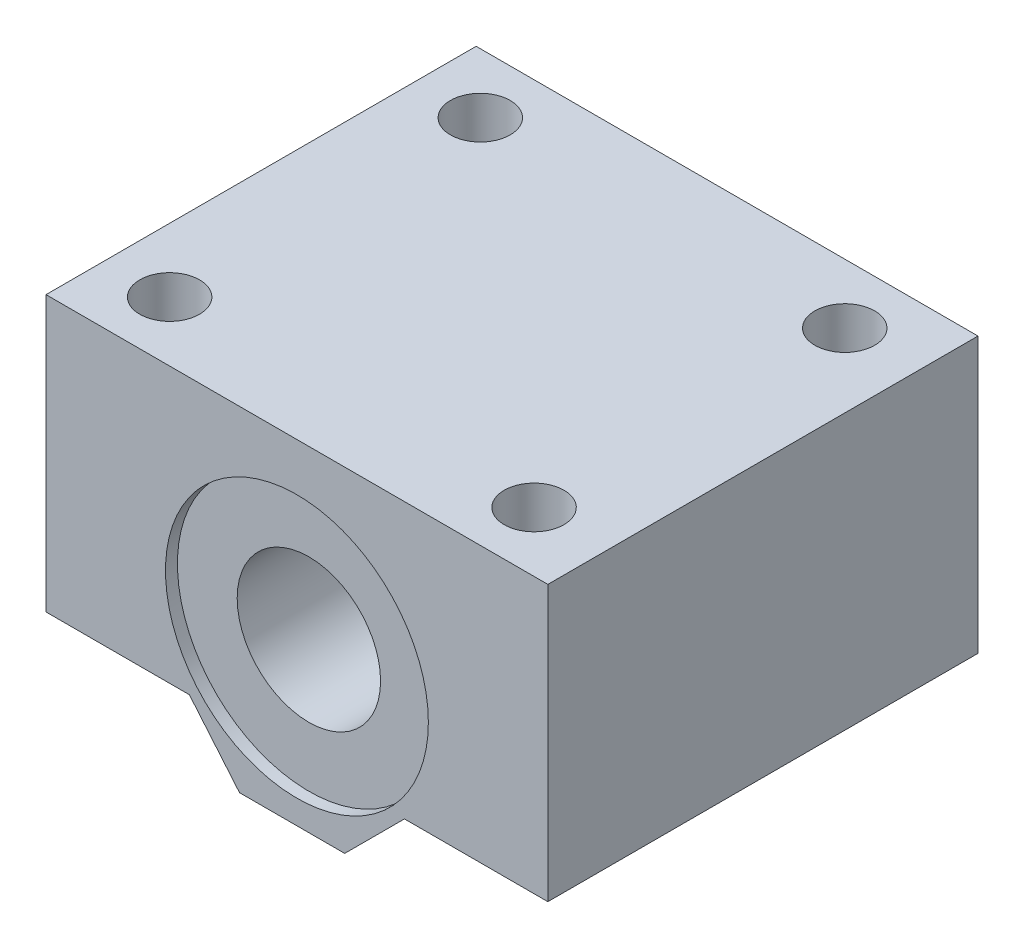
from build123d import *

# Parameters (mm, degrees)
SKETCH1_W           = 42
SKETCH1_H           = 28
SKETCH1_R           = 6
BOSS_EXTRUDE1_DEPTH = 18
CUT_EXTRUDE5_DEPTH  = 44.965895874
SKETCH2_R           = 2.15
CUT_EXTRUDE1_DEPTH  = 40.357337308
SKETCH3_R           = 2.5
CUT_EXTRUDE2_DEPTH  = 12
SKETCH4_R           = 11
CUT_EXTRUDE3_DEPTH  = 1
CUT_EXTRUDE4_START  = -1
SKETCH5_R           = 11
CUT_EXTRUDE4_DEPTH  = 1


with BuildPart() as part:
    # Sketch1 → Boss-Extrude1 (new, symmetric)
    with BuildSketch(Plane.XY):
        Rectangle(SKETCH1_W, SKETCH1_H)
        with Locations((0, -1)):
            Circle(SKETCH1_R, mode=Mode.SUBTRACT)
    extrude(amount=BOSS_EXTRUDE1_DEPTH, both=True)

    # Sketch6 → Cut-Extrude5 (cut, through all)
    with BuildSketch(Plane.XY.offset(18)):
        Polygon((-21, -9), (-9, -9), (-4.804501844, -14), (-21, -14), align=None)
        Polygon((21, -9), (9, -9), (4, -14), (21, -14), align=None)
    extrude(amount=-CUT_EXTRUDE5_DEPTH, mode=Mode.SUBTRACT)

    # Sketch2 → Cut-Extrude1 (cut, through all)
    with BuildSketch(Plane(origin=(0, 14, 0), x_dir=(-1, 0, 0), z_dir=(0, -1, 0))):
        with Locations((15.652250922, -13)):
            Circle(SKETCH2_R)
        with Locations((-14.847749078, -13)):
            Circle(SKETCH2_R)
        with Locations((-14.847749078, 13)):
            Circle(SKETCH2_R)
        with Locations((15.652250922, 13)):
            Circle(SKETCH2_R)
    extrude(amount=CUT_EXTRUDE1_DEPTH, mode=Mode.SUBTRACT)

    # Sketch3 → Cut-Extrude2 (cut)
    with BuildSketch(Plane.XZ.offset(-14)):
        with Locations((-15.652250922, 13)):
            Circle(SKETCH3_R)
        with Locations((14.847749078, 13)):
            Circle(SKETCH3_R)
        with Locations((14.847749078, -13)):
            Circle(SKETCH3_R)
        with Locations((-15.652250922, -13)):
            Circle(SKETCH3_R)
    extrude(amount=CUT_EXTRUDE2_DEPTH, mode=Mode.SUBTRACT)

    # Sketch4 → Cut-Extrude3 (cut)
    with BuildSketch(Plane.XY.offset(18)):
        with Locations((0, -1)):
            Circle(SKETCH4_R)
    extrude(amount=-CUT_EXTRUDE3_DEPTH, mode=Mode.SUBTRACT)

    # Sketch5 → Cut-Extrude4 (cut)
    with BuildSketch(Plane(origin=(0, 0, -18), x_dir=(-1, 0, 0), z_dir=(0, 0, -1)).offset(CUT_EXTRUDE4_START)):
        with Locations((0, -1)):
            Circle(SKETCH5_R)
    extrude(amount=CUT_EXTRUDE4_DEPTH, mode=Mode.SUBTRACT)


solid = part.part
